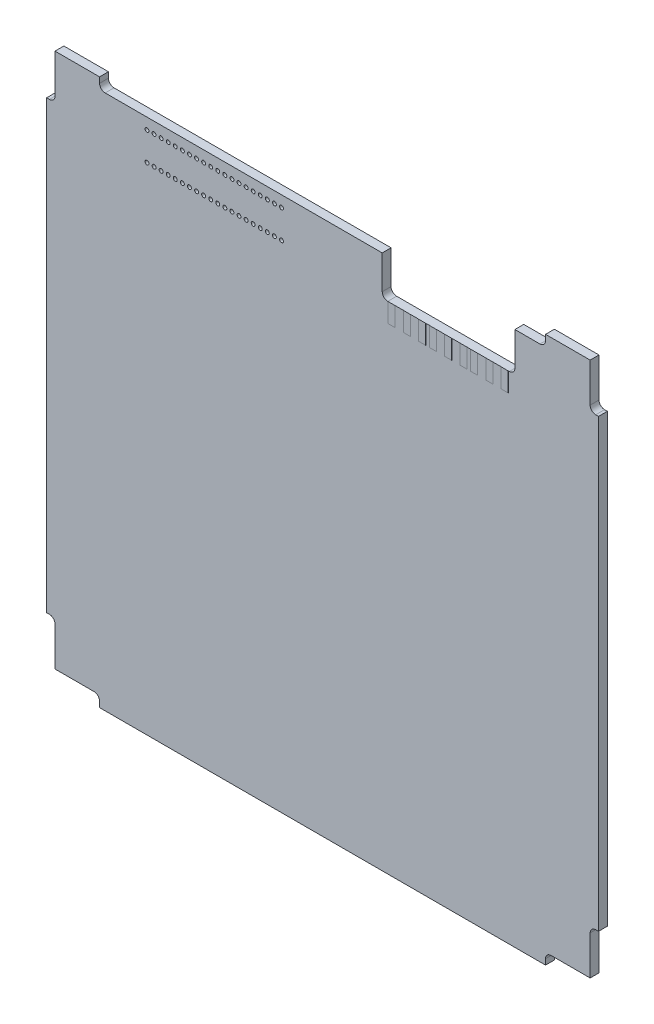
from build123d import *

# Parameters (mm, degrees)
BOSS_EXTRUDE1_DEPTH = 1.5875
SKETCH2_R           = 0.35
CUT_EXTRUDE1_DEPTH  = 71.728496069
CUT_EXTRUDE2_DEPTH  = 11.0216
FILLET2_R           = 1
SKETCH5_OUTSIDE_W   = 130.286
SKETCH5_OUTSIDE_H   = 130.286
SKETCH5_OUTSIDE_W_2 = 99
SKETCH5_OUTSIDE_H_2 = 100
CUT_EXTRUDE3_DEPTH  = 71.728496069
SKETCH6_W           = 1.27
SKETCH6_H           = 3.43
BOSS_EXTRUDE2_DEPTH = 0.01
SKETCH8_W           = 80
SKETCH8_H           = 1.5875
CUT_EXTRUDE4_DEPTH  = 4
FILLET1_R           = 1


with BuildPart() as part:
    # Sketch1 → Boss-Extrude1 (new body)
    with BuildSketch(Plane.XY):
        Polygon((40, 50), (-40, 50), (-40, 48), (-48, 48), (-48, 40), (-50, 40), (-50, -37.864895224), (-50, -40), (-48, -40), (-48, -48), (-40, -48), (-40, -50), (-37.864895224, -50), (40, -50), (40, -48), (48, -48), (48, -40), (50, -40), (50, 40), (48, 40), (48, 48), (40, 48), align=None)
    extrude(amount=BOSS_EXTRUDE1_DEPTH)

    # Sketch2 → Cut-Extrude1 (cut, through all)
    with BuildSketch(Plane.XY.offset(1.5875)):
        with Locations((-31.5, 44)):
            Circle(SKETCH2_R)
        with Locations((-30.23, 44)):
            Circle(SKETCH2_R)
        with Locations((-28.96, 44)):
            Circle(SKETCH2_R)
        with Locations((-27.69, 44)):
            Circle(SKETCH2_R)
        with Locations((-26.42, 44)):
            Circle(SKETCH2_R)
        with Locations((-25.15, 44)):
            Circle(SKETCH2_R)
        with Locations((-23.88, 44)):
            Circle(SKETCH2_R)
        with Locations((-22.61, 44)):
            Circle(SKETCH2_R)
        with Locations((-21.34, 44)):
            Circle(SKETCH2_R)
        with Locations((-20.07, 44)):
            Circle(SKETCH2_R)
        with Locations((-18.8, 44)):
            Circle(SKETCH2_R)
        with Locations((-17.53, 44)):
            Circle(SKETCH2_R)
        with Locations((-16.26, 44)):
            Circle(SKETCH2_R)
        with Locations((-14.99, 44)):
            Circle(SKETCH2_R)
        with Locations((-13.72, 44)):
            Circle(SKETCH2_R)
        with Locations((-12.45, 44)):
            Circle(SKETCH2_R)
        with Locations((-11.18, 44)):
            Circle(SKETCH2_R)
        with Locations((-9.91, 44)):
            Circle(SKETCH2_R)
        with Locations((-8.64, 44)):
            Circle(SKETCH2_R)
        with Locations((-7.37, 44)):
            Circle(SKETCH2_R)
        with Locations((-30.23, 38.92)):
            Circle(SKETCH2_R)
        with Locations((-28.96, 38.92)):
            Circle(SKETCH2_R)
        with Locations((-27.69, 38.92)):
            Circle(SKETCH2_R)
        with Locations((-26.42, 38.92)):
            Circle(SKETCH2_R)
        with Locations((-25.15, 38.92)):
            Circle(SKETCH2_R)
        with Locations((-23.88, 38.92)):
            Circle(SKETCH2_R)
        with Locations((-22.61, 38.92)):
            Circle(SKETCH2_R)
        with Locations((-21.34, 38.92)):
            Circle(SKETCH2_R)
        with Locations((-20.07, 38.92)):
            Circle(SKETCH2_R)
        with Locations((-18.8, 38.92)):
            Circle(SKETCH2_R)
        with Locations((-17.53, 38.92)):
            Circle(SKETCH2_R)
        with Locations((-16.26, 38.92)):
            Circle(SKETCH2_R)
        with Locations((-14.99, 38.92)):
            Circle(SKETCH2_R)
        with Locations((-13.72, 38.92)):
            Circle(SKETCH2_R)
        with Locations((-12.45, 38.92)):
            Circle(SKETCH2_R)
        with Locations((-11.18, 38.92)):
            Circle(SKETCH2_R)
        with Locations((-9.91, 38.92)):
            Circle(SKETCH2_R)
        with Locations((-8.64, 38.92)):
            Circle(SKETCH2_R)
        with Locations((-7.37, 38.92)):
            Circle(SKETCH2_R)
        with Locations((-31.5, 38.92)):
            Circle(SKETCH2_R)
    extrude(amount=-CUT_EXTRUDE1_DEPTH, mode=Mode.SUBTRACT)

    # Sketch3 → Cut-Extrude2 (cut)
    with BuildSketch(Plane(origin=(0, 50, 0), x_dir=(1, 0, 0), z_dir=(0, 1, 0))):
        Polygon((10.7, 0), (19.7, 0), (34.5, 0), (34.5, -1.5875), (19.7, -1.5875), (10.7, -1.5875), align=None)
    extrude(amount=-CUT_EXTRUDE2_DEPTH, mode=Mode.SUBTRACT)

    # Fillet2
    fillet2_edges = [part.edges().sort_by_distance(p)[0] for p in [
        (10.7, 38.9784, 0.79375),
        (34.5, 38.9784, 0.79375),
    ]]
    fillet(fillet2_edges, radius=FILLET2_R)

    # Sketch5 outside → Cut-Extrude3 (cut, through all)
    with BuildSketch(Plane(origin=(0, 0, 0), x_dir=(-1, 0, 0), z_dir=(0, 0, -1))):
        Rectangle(SKETCH5_OUTSIDE_W, SKETCH5_OUTSIDE_H)
        Rectangle(SKETCH5_OUTSIDE_W_2, SKETCH5_OUTSIDE_H_2, mode=Mode.SUBTRACT)
    extrude(amount=-CUT_EXTRUDE3_DEPTH, mode=Mode.SUBTRACT)

    # Sketch6 → Boss-Extrude2 (add)
    with BuildSketch(Plane.XY.offset(1.5875)):
        with Locations((12.4, 37.2634)):
            Rectangle(SKETCH6_W, SKETCH6_H)
        with Locations((15.14, 37.2634)):
            Rectangle(SKETCH6_W, SKETCH6_H)
        with Locations((17.88, 37.2634)):
            Rectangle(SKETCH6_W, SKETCH6_H)
        with Locations((19.8, 37.2634)):
            Rectangle(SKETCH6_W, SKETCH6_H)
        with Locations((22.54, 37.2634)):
            Rectangle(SKETCH6_W, SKETCH6_H)
        with Locations((25.28, 37.2634)):
            Rectangle(SKETCH6_W, SKETCH6_H)
        with Locations((27.2, 37.2634)):
            Rectangle(SKETCH6_W, SKETCH6_H)
        with Locations((29.94, 37.2634)):
            Rectangle(SKETCH6_W, SKETCH6_H)
        with Locations((32.68, 37.2634)):
            Rectangle(SKETCH6_W, SKETCH6_H)
    extrude(amount=BOSS_EXTRUDE2_DEPTH)

    # Sketch8 → Cut-Extrude4 (cut)
    with BuildSketch(Plane(origin=(0, 50, 0), x_dir=(1, 0, 0), z_dir=(0, 1, 0))):
        with Locations((0, -0.79375)):
            Rectangle(SKETCH8_W, SKETCH8_H)
    extrude(amount=-CUT_EXTRUDE4_DEPTH, mode=Mode.SUBTRACT)

    # Fillet1
    fillet1_edges = [part.edges().sort_by_distance(p)[0] for p in [
        (-48, -40, 0.79375),
        (-40, -48, 0.79375),
        (40, -48, 0.79375),
        (48, -40, 0.79375),
        (48, 40, 0.79375),
        (-48, 40, 0.79375),
        (40, 46, 0.79375),
        (-40, 46, 0.79375),
    ]]
    fillet(fillet1_edges, radius=FILLET1_R)


solid = part.part
